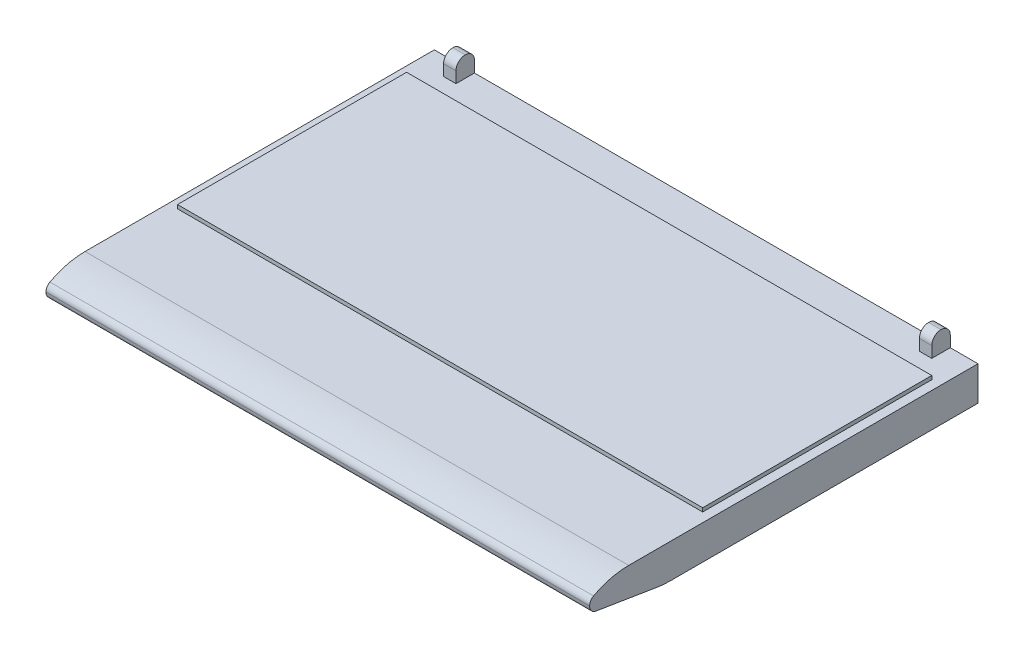
from build123d import *

# Parameters (mm, degrees)
SKETCH1_W           = 294
SKETCH1_H           = 210
BOSS_EXTRUDE1_DEPTH = 18.5
CUT_EXTRUDE1_DEPTH  = 300
CHAMFER1_SIZE       = 6
CHAMFER1_SIZE2      = 10.392304845
FILLET1_R           = 40
FILLET2_R           = 4
FILLET3_R           = 50
SKETCH3_W           = 6.7
SKETCH3_H           = 10
BOSS_EXTRUDE2_DEPTH = 11
FILLET4_R           = 5
SKETCH4_W           = 284
SKETCH4_H           = 123.889727457
BOSS_EXTRUDE3_DEPTH = 2


with BuildPart() as part:
    # Sketch1 → Boss-Extrude1 (new body)
    with BuildSketch(Plane(origin=(0, 0, 0), x_dir=(1, 0, 0), z_dir=(0, 1, 0))):
        Rectangle(SKETCH1_W, SKETCH1_H)
    extrude(amount=BOSS_EXTRUDE1_DEPTH)

    # Sketch2 → Cut-Extrude1 (cut)
    with BuildSketch(Plane(origin=(147, 0, 0), x_dir=(0, 0, -1), z_dir=(1, 0, 0))):
        Polygon((-105, 6.5), (-65, 0), (-105, 0), align=None)
    extrude(amount=-CUT_EXTRUDE1_DEPTH, mode=Mode.SUBTRACT)

    # Chamfer1
    chamfer1_edges = [part.edges().sort_by_distance(p)[0] for p in [
        (0, 18.5, 105),
    ]]
    chamfer1_side = [part.faces().sort_by_distance(p)[0] for p in [
        (0, 12.5, 105),
    ]]
    chamfer(chamfer1_edges, length=CHAMFER1_SIZE, length2=CHAMFER1_SIZE2, reference=chamfer1_side[0])

    # Fillet1
    fillet1_edges = [part.edges().sort_by_distance(p)[0] for p in [
        (0, 18.5, 94.607695155),
    ]]
    fillet(fillet1_edges, radius=FILLET1_R)

    # Fillet2
    fillet2_edges = [part.edges().sort_by_distance(p)[0] for p in [
        (0, 6.5, 105),
        (0, 12.5, 105),
    ]]
    fillet(fillet2_edges, radius=FILLET2_R)

    # Fillet3
    fillet3_edges = [part.edges().sort_by_distance(p)[0] for p in [
        (0, 0, 65),
    ]]
    fillet(fillet3_edges, radius=FILLET3_R)

    # Sketch3 → Boss-Extrude2 (add)
    with BuildSketch(Plane(origin=(0, 18.5, 0), x_dir=(1, 0, 0), z_dir=(0, 1, 0))):
        with Locations((128.65, 100)):
            Rectangle(SKETCH3_W, SKETCH3_H)
        with Locations((-128.65, 100)):
            Rectangle(SKETCH3_W, SKETCH3_H)
    extrude(amount=BOSS_EXTRUDE2_DEPTH)

    # Fillet4
    fillet4_edges = [part.edges().sort_by_distance(p)[0] for p in [
        (128.65, 29.5, -105),
        (128.65, 29.5, -95),
        (-128.65, 29.5, -105),
        (-128.65, 29.5, -95),
    ]]
    fillet(fillet4_edges, radius=FILLET4_R - 0.0001)  # a hair under: the kernel refuses the full size

    # Sketch4 → Boss-Extrude3 (add)
    with BuildSketch(Plane(origin=(0, 18.5, 0), x_dir=(1, 0, 0), z_dir=(0, 1, 0))):
        with Locations((0, 23.055136272)):
            Rectangle(SKETCH4_W, SKETCH4_H)
    extrude(amount=BOSS_EXTRUDE3_DEPTH)


solid = part.part
